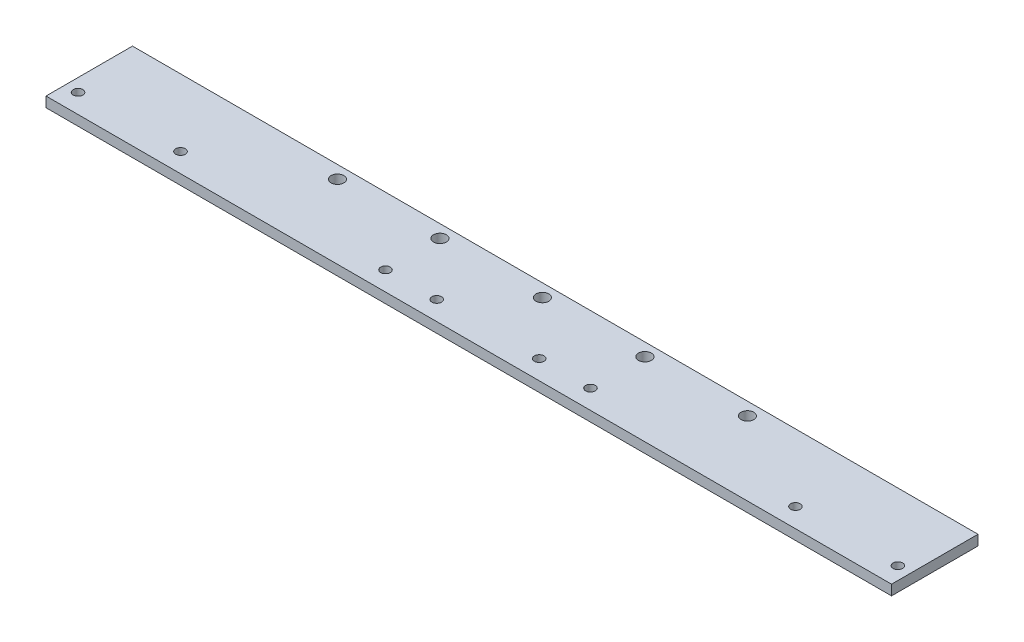
from build123d import *

# Parameters (mm, degrees)
SKETCH1_R           = 2
SKETCH1_R_2         = 1.5
BOSS_EXTRUDE1_DEPTH = 3.175
SKETCH2_R           = 1.5
CUT_EXTRUDE1_DEPTH  = 10


with BuildPart() as part:
    # Sketch1 → Boss-Extrude1 (new body)
    with BuildSketch(Plane(origin=(0, 0, 0), x_dir=(1, 0, 0), z_dir=(0, 1, 0))):
        Polygon((0, 25.535634143), (0, -1.464365857), (264, -1.464365857), (264, 4.535634143), (264, 25.535634143), align=None)
        with Locations((132, 21.535634143)):
            Circle(SKETCH1_R, mode=Mode.SUBTRACT)
        with Locations((100, 21.535634143)):
            Circle(SKETCH1_R, mode=Mode.SUBTRACT)
        with Locations((68, 21.535634143)):
            Circle(SKETCH1_R, mode=Mode.SUBTRACT)
        with Locations((196, 21.535634143)):
            Circle(SKETCH1_R, mode=Mode.SUBTRACT)
        with Locations((164, 21.535634143)):
            Circle(SKETCH1_R, mode=Mode.SUBTRACT)
        with Locations((260, 4.535634143)):
            Circle(SKETCH1_R_2, mode=Mode.SUBTRACT)
        with Locations((36, 4.535634143)):
            Circle(SKETCH1_R_2, mode=Mode.SUBTRACT)
        with Locations((228, 4.535634143)):
            Circle(SKETCH1_R_2, mode=Mode.SUBTRACT)
        with Locations((4, 4.535634143)):
            Circle(SKETCH1_R_2, mode=Mode.SUBTRACT)
    extrude(amount=BOSS_EXTRUDE1_DEPTH)

    # Sketch2 → Cut-Extrude1 (cut)
    with BuildSketch(Plane(origin=(0, 3.175, 0), x_dir=(1, 0, 0), z_dir=(0, 1, 0))):
        with Locations((116, 4.535634143)):
            Circle(SKETCH2_R)
        with Locations((148, 4.535634143)):
            Circle(SKETCH2_R)
        with Locations((100, 4.535634143)):
            Circle(SKETCH2_R)
        with Locations((164, 4.535634143)):
            Circle(SKETCH2_R)
    extrude(amount=-CUT_EXTRUDE1_DEPTH, mode=Mode.SUBTRACT)


solid = part.part
